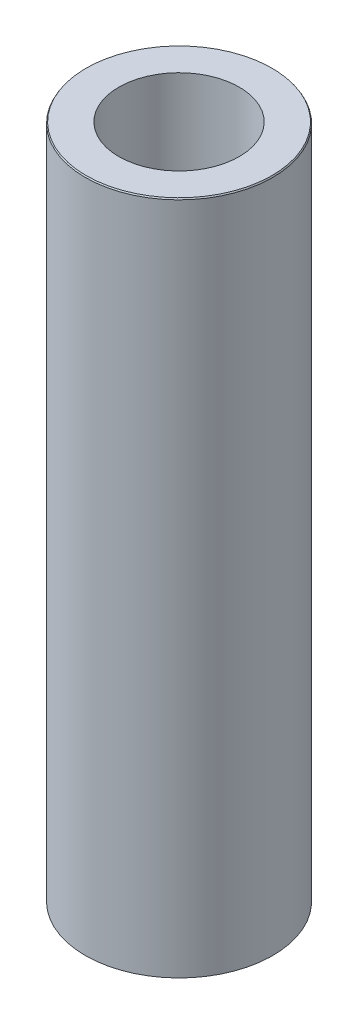
from build123d import *
from OCP.BRepFilletAPI import BRepFilletAPI_MakeChamfer

# Parameters (mm, degrees)
SKETCH1_R           = 42.5
BOSS_EXTRUDE1_DEPTH = 306.475914404
SKETCH2_R           = 27.305033312
CUT_EXTRUDE1_DEPTH  = 313.313922376
CHAMFER1_SIZE       = 0.589423959
CHAMFER1_SIZE2      = 0.340304081


with BuildPart() as part:
    # Sketch1 → Boss-Extrude1 (new body)
    with BuildSketch(Plane(origin=(0, 0, 0), x_dir=(1, 0, 0), z_dir=(0, 1, 0))):
        Circle(SKETCH1_R)
    extrude(amount=BOSS_EXTRUDE1_DEPTH)

    # Sketch2 → Cut-Extrude1 (cut, through all)
    with BuildSketch(Plane(origin=(0, 0, 0), x_dir=(1, 0, 0), z_dir=(0, 1, 0))):
        Circle(SKETCH2_R)
    extrude(amount=CUT_EXTRUDE1_DEPTH, mode=Mode.SUBTRACT)

    # Chamfer1: one chamfer whose edges measure the first distance from different faces: ONE call of the kernel's chamfer builder (chamfer() names one face for all edges)
    chamfer1_edges_1 = [part.edges().sort_by_distance(p)[0] for p in [
        (-42.5, 306.475914404, 0),
    ]]
    chamfer1_side_1 = [part.faces().sort_by_distance(p)[0] for p in [
        (-42.5, 153.237957202, 0),
    ]]
    chamfer1_edges_2 = [part.edges().sort_by_distance(p)[0] for p in [
        (-42.5, 0, 0),
    ]]
    chamfer1_side_2 = [part.faces().sort_by_distance(p)[0] for p in [
        (-41.297918472, 0, 0),
    ]]
    chamfer1 = BRepFilletAPI_MakeChamfer(part.part.solid().wrapped)
    for e in chamfer1_edges_1:
        chamfer1.Add(CHAMFER1_SIZE, CHAMFER1_SIZE2, e.wrapped, chamfer1_side_1[0].wrapped)  # the first distance lies on this face
    for e in chamfer1_edges_2:
        chamfer1.Add(CHAMFER1_SIZE, CHAMFER1_SIZE2, e.wrapped, chamfer1_side_2[0].wrapped)  # the first distance lies on this face
    add(Compound.cast(chamfer1.Shape()), mode=Mode.REPLACE)


solid = part.part
